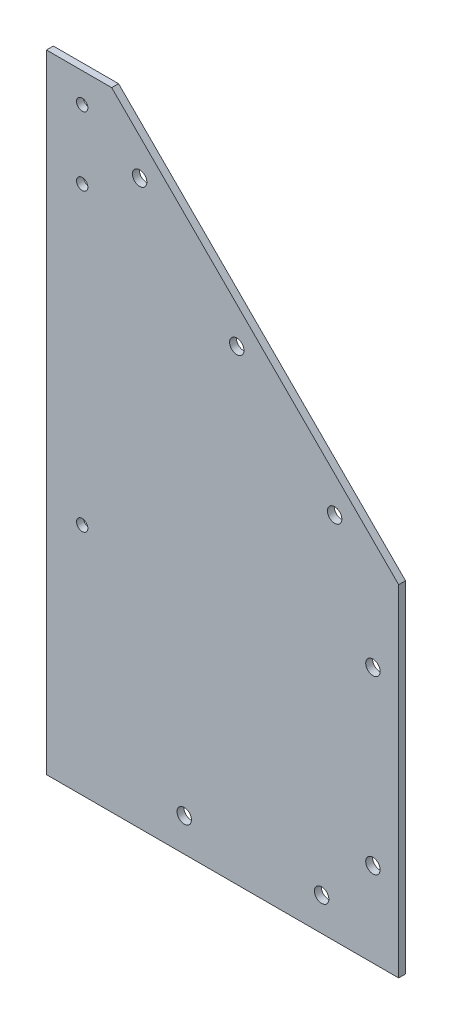
from build123d import *

# Parameters (mm, degrees)
SKETCH_1_R          = 2.1
EXTRUDE_1_DEPTH     = 2
SKETCH_2_R          = 2.1
CUT_EXTRUDE_1_DEPTH = 10
M4X0_7_1_OUTLINE_W  = 19
M4X0_7_1_OUTLINE_H  = 182.73
M4X0_7_1_OUTLINE_R  = 1.65
M4X0_7_1_DEPTH      = 2


# Read off the part's stored shape, not the designer's step: M4x0.7 ねじ穴1
with BuildPart() as part:
    # ｽｹｯﾁ1 → ﾎﾞｽ - 押し出し1 (new body)
    with BuildSketch(Plane.XY):
        Polygon((0, 0), (0, 182.73), (83.56, 99.17), (83.56, 0), align=None)
        with Locations((8.132919651, 163.990478631)):
            Circle(SKETCH_1_R, mode=Mode.SUBTRACT)
        with Locations((36.417190898, 135.706207384)):
            Circle(SKETCH_1_R, mode=Mode.SUBTRACT)
        with Locations((64.91002614, 107.428490375)):
            Circle(SKETCH_1_R, mode=Mode.SUBTRACT)
        with Locations((76.06, 74.59)):
            Circle(SKETCH_1_R, mode=Mode.SUBTRACT)
        with Locations((76.06, 24.59)):
            Circle(SKETCH_1_R, mode=Mode.SUBTRACT)
    extrude(amount=EXTRUDE_1_DEPTH)

    # ｽｹｯﾁ2 → ｶｯﾄ - 押し出し1 (cut)
    with BuildSketch(Plane.XY.offset(2)):
        with Locations((21.12, 9.69)):
            Circle(SKETCH_2_R)
        with Locations((61.12, 9.69)):
            Circle(SKETCH_2_R)
    extrude(amount=-CUT_EXTRUDE_1_DEPTH, mode=Mode.SUBTRACT)

    # M4x0.7 ねじ穴1 outline → M4x0.7 ねじ穴1 (add)
    with BuildSketch(Plane.XY):
        with Locations((-9.5, 91.365)):
            Rectangle(M4X0_7_1_OUTLINE_W, M4X0_7_1_OUTLINE_H)
        with Locations((-8.59, 68.15)):
            Circle(M4X0_7_1_OUTLINE_R, mode=Mode.SUBTRACT)
        with Locations((-8.59, 154.15)):
            Circle(M4X0_7_1_OUTLINE_R, mode=Mode.SUBTRACT)
        with Locations((-8.59, 174.15)):
            Circle(M4X0_7_1_OUTLINE_R, mode=Mode.SUBTRACT)
    extrude(amount=M4X0_7_1_DEPTH)


solid = part.part
